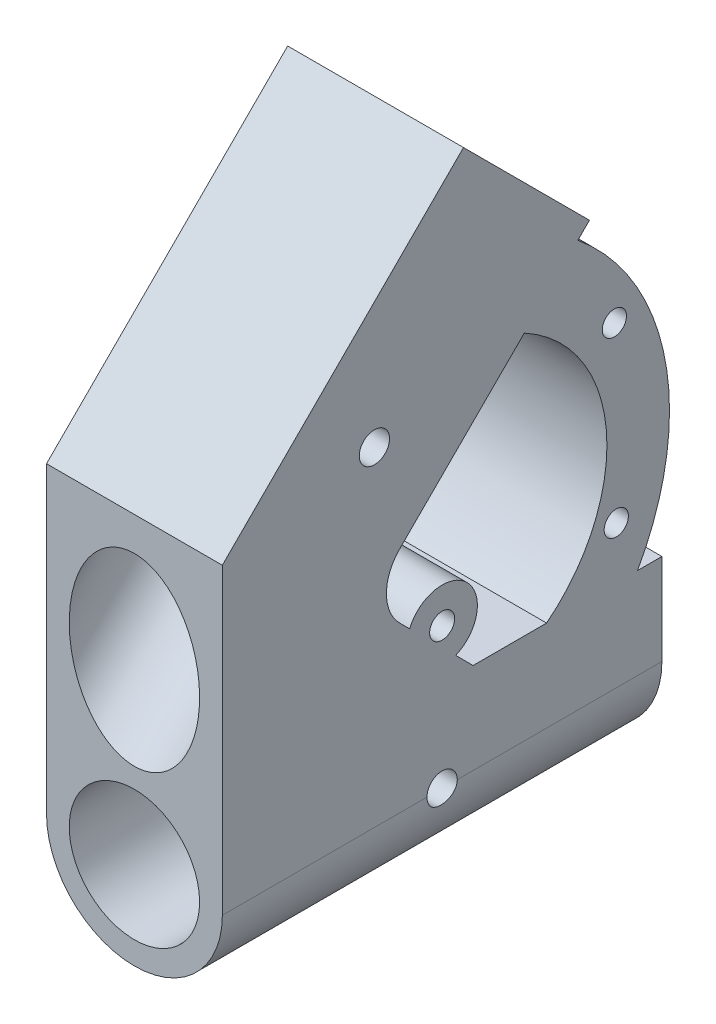
from build123d import *

# Parameters (mm, degrees)
CROQUIS1_R              = 8.6
SALIENTE_EXTRUIR1_DEPTH = 29
SALIENTE_EXTRUIR2_DEPTH = 11.6
CROQUIS3_R              = 8.6
CORTAR_EXTRUIR1_DEPTH   = 73
SALIENTE_EXTRUIR3_DEPTH = 11.6
CROQUIS5_R              = 4.65
CROQUIS5_R_2            = 1.65
SALIENTE_EXTRUIR4_DEPTH = 11.6
CROQUIS6_R              = 1.6
CORTAR_EXTRUIR2_DEPTH   = 15
CROQUIS7_R              = 2
CORTAR_EXTRUIR3_DEPTH   = 26.5


with BuildPart() as part:
    # Croquis1 → Saliente-Extruir1 (new, symmetric)
    with BuildSketch(Plane.XY):
        with BuildLine():
            Line((-11.6, 12), (11.6, 12))
            Line((11.6, 12), (11.6, 0))
            ThreePointArc((11.6, 0), (0, -11.6), (-11.6, 0))
            Line((-11.6, 0), (-11.6, 12))
        make_face()
        Circle(CROQUIS1_R, mode=Mode.SUBTRACT)
    extrude(amount=SALIENTE_EXTRUIR1_DEPTH, both=True)

    # Croquis2 → Saliente-Extruir2 (add, symmetric)
    with BuildSketch(Plane(origin=(0, 0, 0), x_dir=(0, 0, -1), z_dir=(1, 0, 0))):
        with BuildLine():
            Line((-29, 12), (-29, 40))
            Line((-29, 40), (2.819805153, 71.819805153))
            Line((2.819805153, 71.819805153), (19.436814511, 55.202795796))
            Line((19.436814511, 55.202795796), (-5.595299788, 30.170681496))
            ThreePointArc((-5.595299788, 30.170681496), (-7.352659101, 25.928040809), (-5.595299788, 21.685400122))
            Line((-5.595299788, 21.685400122), (4.090100333, 12))
            Line((4.090100333, 12), (-29, 12))
        make_face()
    extrude(amount=SALIENTE_EXTRUIR2_DEPTH, both=True)

    # Croquis3 → Cortar-Extruir1 (cut)
    with BuildSketch(Plane(origin=(0, 37.319805153, -37.319805153), x_dir=(1, 0, 0), z_dir=(0, 0.7071067811865465, -0.7071067811865487))):
        with Locations((0, -37.040367902)):
            Circle(CROQUIS3_R)
    extrude(amount=-CORTAR_EXTRUIR1_DEPTH, mode=Mode.SUBTRACT)

    # Croquis4 → Saliente-Extruir3 (add, symmetric)
    with BuildSketch(Plane(origin=(0, 0, 0), x_dir=(0, 0, -1), z_dir=(1, 0, 0))):
        with BuildLine():
            Line((10.836721088, 46.602702372), (17.9077889, 53.673770184))
            ThreePointArc((17.9077889, 53.673770184), (29.426171787, 34.269401184), (25.782485256, 12))
            Line((25.782485256, 12), (13.782485256, 12))
            ThreePointArc((13.782485256, 12), (21.669878489, 30.098201193), (10.836721088, 46.602702372))
        make_face()
    extrude(amount=SALIENTE_EXTRUIR3_DEPTH, both=True)

    # Croquis5 → Saliente-Extruir4 (add, symmetric)
    with BuildSketch(Plane(origin=(0, 0, 0), x_dir=(0, 0, -1), z_dir=(1, 0, 0))):
        with Locations((0, 18.59255238)):
            Circle(CROQUIS5_R)
        with Locations((0, 18.59255238)):
            Circle(CROQUIS5_R_2, mode=Mode.SUBTRACT)
    extrude(amount=SALIENTE_EXTRUIR4_DEPTH, both=True)

    # Croquis6 → Cortar-Extruir2 (cut, symmetric)
    with BuildSketch(Plane(origin=(0, 0, 0), x_dir=(0, 0, -1), z_dir=(1, 0, 0))):
        with Locations((22.726275042, 41.82542613)):
            Circle(CROQUIS6_R)
        with Locations((22.98, 18.84542613)):
            Circle(CROQUIS6_R)
    extrude(amount=CORTAR_EXTRUIR2_DEPTH, both=True, mode=Mode.SUBTRACT)

    # Croquis7 → Cortar-Extruir3 (cut, symmetric)
    with BuildSketch(Plane(origin=(0, 0, 0), x_dir=(0, 0, -1), z_dir=(1, 0, 0))):
        Circle(CROQUIS7_R)
        with Locations((-8.935845084, 43.447145558)):
            Circle(CROQUIS7_R)
    extrude(amount=CORTAR_EXTRUIR3_DEPTH, both=True, mode=Mode.SUBTRACT)


solid = part.part
